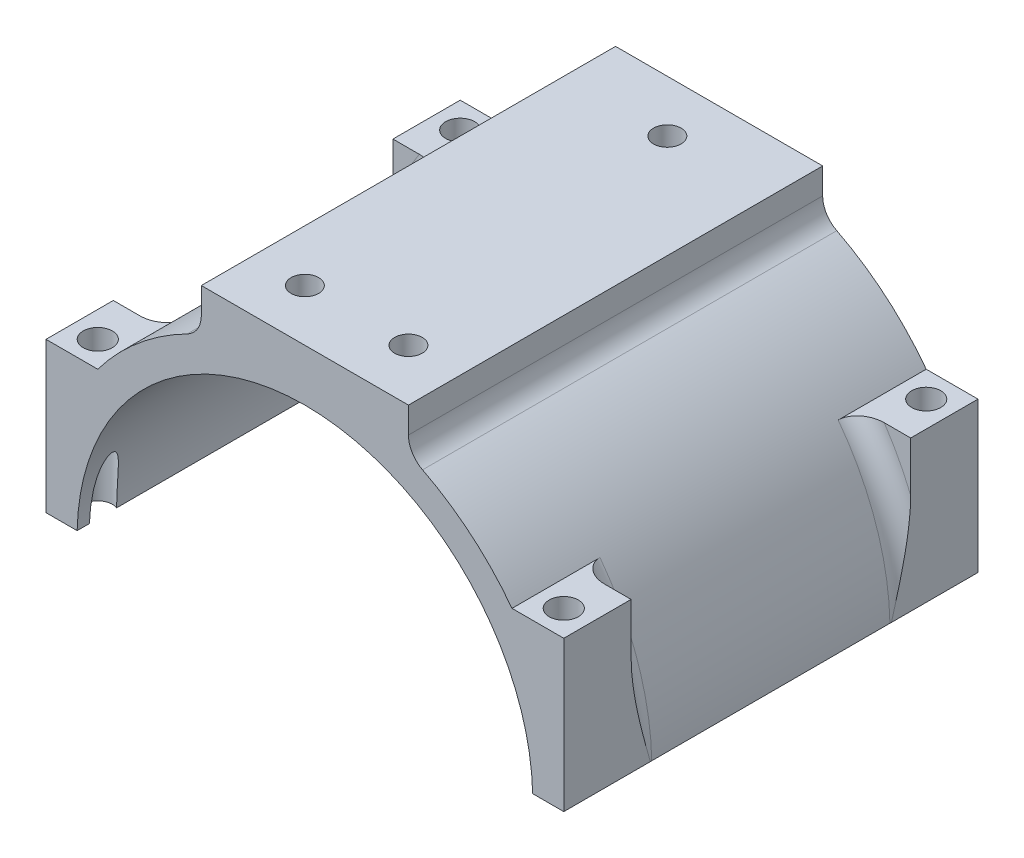
from build123d import *

# Parameters (mm, degrees)
BOSS_EXTRUDE1_DEPTH                          = 50.8
BOSS_EXTRUDE2_START                          = -16.51
BOSS_EXTRUDE2_DEPTH                          = 16.51
SKETCH4_W                                    = 127
SKETCH4_H                                    = 1.27
CUT_EXTRUDE1_DEPTH                           = 136.598893801
F_1_4_CLEARANCE_HOLE1_D                      = 7.14248
FILLET1_R                                    = 5.08
SKETCH7_W                                    = 50.8
SKETCH7_H                                    = 12.7
BOSS_EXTRUDE3_DEPTH                          = 101.6
FILLET2_R                                    = 6.35
CBORE_START                                  = 52.832
CBORE_FOR_1_4_SOCKET_HEAD_CAP_SCREW1_OUT_R   = 5.55625
CBORE_FOR_1_4_SOCKET_HEAD_CAP_SCREW1_DEPTH   = 10.16
CBORE_START_2                                = 62.992
CBORE_FOR_1_4_SOCKET_HEAD_CAP_SCREW1_2_O_R   = 3.3782
CBORE_FOR_1_4_SOCKET_HEAD_CAP_SCREW1_2_DEPTH = 5.588


# Read off the part's stored shape, not the designer's step: CBORE for 1/4 Socket Head Cap Screw1
with BuildPart() as part:
    # Sketch1 → Boss-Extrude1 (new, symmetric)
    with BuildSketch(Plane.XY):
        with BuildLine():
            Line((55.88, 0), (63.5, 0))
            ThreePointArc((63.5, 0), (0, 63.5), (-63.5, 0))
            Line((-63.5, 0), (-55.88, 0))
            ThreePointArc((-55.88, 0), (0, 55.88), (55.88, 0))
        make_face()
    extrude(amount=BOSS_EXTRUDE1_DEPTH, both=True)

    # Sketch2 → Boss-Extrude2 (add)
    with BuildSketch(Plane(origin=(0, 0, -50.8), x_dir=(-1, 0, 0), z_dir=(0, 0, -1)).offset(BOSS_EXTRUDE2_START)):
        with BuildLine():
            Line((-63.5, 38.1), (-63.5, 0))
            ThreePointArc((-63.5, 0), (-60.241389426, 20.080463142), (-50.8, 38.1))
            Line((-50.8, 38.1), (-63.5, 38.1))
        make_face()
        with BuildLine():
            Line((63.5, 38.1), (50.8, 38.1))
            ThreePointArc((50.8, 38.1), (60.241389426, 20.080463142), (63.5, 0))
            Line((63.5, 0), (63.5, 38.1))
        make_face()
    boss_extrude2 = extrude(amount=BOSS_EXTRUDE2_DEPTH)

    # Mirror1: Boss-Extrude2 across plane
    add(boss_extrude2.mirror(Plane.XY))

    # Sketch4 → Cut-Extrude1 (cut, through all)
    with BuildSketch(Plane.XY.offset(50.8)):
        with Locations((0, 0.635)):
            Rectangle(SKETCH4_W, SKETCH4_H)
    extrude(amount=-CUT_EXTRUDE1_DEPTH, mode=Mode.SUBTRACT)

    # 1/4 Clearance Hole1 (through all)
    with Locations(Plane(origin=(-57.15, 38.1, -44.45), x_dir=(0, 0, 1), z_dir=(0, 1, 0))):
        with Locations((0, 0), (0, 114.3), (88.9, 0), (88.9, 114.3)):
            Hole(F_1_4_CLEARANCE_HOLE1_D / 2)

    # Fillet1
    fillet1_edges = [part.edges().sort_by_distance(p)[0] for p in [
        (60.037562307, 20.681903014, 34.29),
        (-60.037562307, 20.681903014, 34.29),
        (-60.037562307, 20.681903014, -34.29),
        (60.037562307, 20.681903014, -34.29),
    ]]
    fillet(fillet1_edges, radius=FILLET1_R)

    # Sketch7 → Boss-Extrude3 (add)
    with BuildSketch(Plane(origin=(0, 0, -50.8), x_dir=(-1, 0, 0), z_dir=(0, 0, -1))):
        with Locations((0, 62.23)):
            Rectangle(SKETCH7_W, SKETCH7_H)
    extrude(amount=-BOSS_EXTRUDE3_DEPTH)

    # Fillet2
    fillet2_edges = [part.edges().sort_by_distance(p)[0] for p in [
        (-25.4, 58.198711326, 0),
        (25.4, 58.198711326, 0),
    ]]
    fillet(fillet2_edges, radius=FILLET2_R)

    # CBORE for 1/4 Socket Head Cap Screw1 out → CBORE for 1/4 Socket Head Cap Screw1 (cut)
    with BuildSketch(Plane(origin=(0, 0, 0), x_dir=(1, 0, 0), z_dir=(0, 1, 0)).offset(CBORE_START)):
        with Locations((-12.7, -38.1)):
            Circle(CBORE_FOR_1_4_SOCKET_HEAD_CAP_SCREW1_OUT_R)
        with Locations((12.7, -38.1)):
            Circle(CBORE_FOR_1_4_SOCKET_HEAD_CAP_SCREW1_OUT_R)
        with Locations((0, 38.1)):
            Circle(CBORE_FOR_1_4_SOCKET_HEAD_CAP_SCREW1_OUT_R)
    extrude(amount=CBORE_FOR_1_4_SOCKET_HEAD_CAP_SCREW1_DEPTH, mode=Mode.SUBTRACT)

    # CBORE for 1_4 Socket Head Cap Screw1 2 o → CBORE for 1_4 Socket Head Cap Screw1 2 (cut)
    with BuildSketch(Plane(origin=(0, 0, 0), x_dir=(1, 0, 0), z_dir=(0, 1, 0)).offset(CBORE_START_2)):
        with Locations((-12.7, -38.1)):
            Circle(CBORE_FOR_1_4_SOCKET_HEAD_CAP_SCREW1_2_O_R)
        with Locations((12.7, -38.1)):
            Circle(CBORE_FOR_1_4_SOCKET_HEAD_CAP_SCREW1_2_O_R)
        with Locations((0, 38.1)):
            Circle(CBORE_FOR_1_4_SOCKET_HEAD_CAP_SCREW1_2_O_R)
    extrude(amount=CBORE_FOR_1_4_SOCKET_HEAD_CAP_SCREW1_2_DEPTH, mode=Mode.SUBTRACT)


solid = part.part
